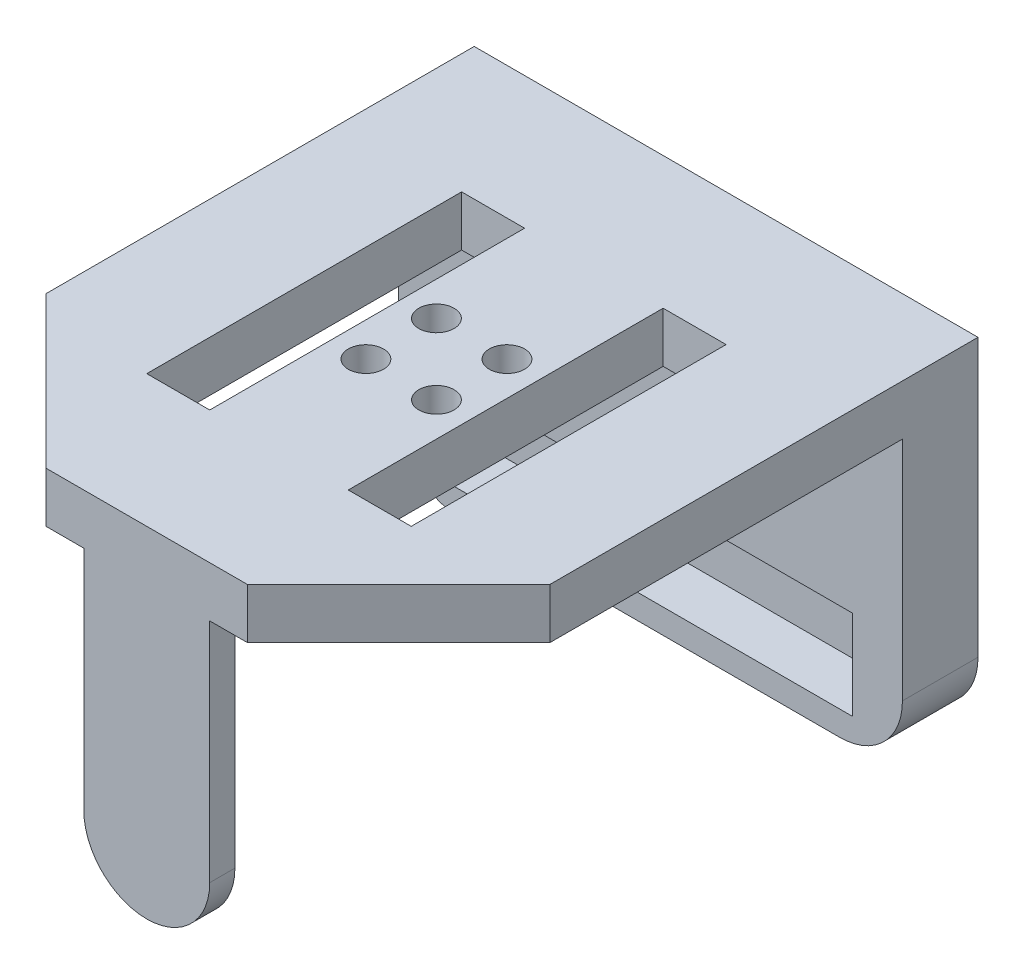
from build123d import *

# Parameters (mm, degrees)
SCHIZZO3_W                   = 40
SCHIZZO3_H                   = 27
ESTRUSIONE_ESTRUSIONE1_DEPTH = 6
SCHIZZO4_W                   = 32.1
SCHIZZO4_H                   = 7.1
TAGLIO_ESTRUSIONE1_DEPTH     = 4
SCHIZZO5_R                   = 1.05
TAGLIO_ESTRUSIONE2_DEPTH     = 25.459149617
SCHIZZO6_W                   = 40
SCHIZZO6_H                   = 4
ESTRUSIONE_ESTRUSIONE2_DEPTH = 40
SCHIZZO7_W                   = 10
SCHIZZO7_H                   = 2
ESTRUSIONE_ESTRUSIONE3_DEPTH = 23
SCHIZZO8_R                   = 1.4
SCHIZZO8_W                   = 5
SCHIZZO8_H                   = 25
TAGLIO_ESTRUSIONE3_DEPTH     = 57.964901475
RACCORDO1_R                  = 5


with BuildPart() as part:
    # Schizzo3 → Estrusione-Estrusione1 (new body)
    with BuildSketch(Plane.XY):
        Rectangle(SCHIZZO3_W, SCHIZZO3_H)
    extrude(amount=ESTRUSIONE_ESTRUSIONE1_DEPTH)

    # Schizzo4 → Taglio-Estrusione1 (cut)
    with BuildSketch(Plane.XY.offset(6)):
        with Locations((0, -8)):
            Rectangle(SCHIZZO4_W, SCHIZZO4_H)
    extrude(amount=-TAGLIO_ESTRUSIONE1_DEPTH, mode=Mode.SUBTRACT)

    # Schizzo5 → Taglio-Estrusione2 (cut, through all)
    with BuildSketch(Plane.XY.offset(2)):
        with Locations((0, -8)):
            Circle(SCHIZZO5_R)
    extrude(amount=-TAGLIO_ESTRUSIONE2_DEPTH, mode=Mode.SUBTRACT)

    # Schizzo6 → Estrusione-Estrusione2 (add)
    with BuildSketch(Plane.XY.offset(6)):
        with Locations((0, 11.5)):
            Rectangle(SCHIZZO6_W, SCHIZZO6_H)
    extrude(amount=ESTRUSIONE_ESTRUSIONE2_DEPTH)

    # Schizzo7 → Estrusione-Estrusione3 (add)
    with BuildSketch(Plane.XZ.offset(-9.5)):
        with Locations((0, 45)):
            Rectangle(SCHIZZO7_W, SCHIZZO7_H)
    extrude(amount=ESTRUSIONE_ESTRUSIONE3_DEPTH)

    # Schizzo8 → Taglio-Estrusione3 (cut, through all)
    with BuildSketch(Plane(origin=(0, 13.5, 0), x_dir=(1, 0, 0), z_dir=(0, 1, 0))):
        with Locations(Location((-2.8, -20.2, 0), (0, 0, 270))):
            Circle(SCHIZZO8_R)
        with Locations(Location((-2.8, -25.8, 0), (0, 0, 270))):
            Circle(SCHIZZO8_R)
        with Locations(Location((2.8, -25.8, 0), (0, 0, 270))):
            Circle(SCHIZZO8_R)
        with Locations(Location((2.8, -20.2, 0), (0, 0, 270))):
            Circle(SCHIZZO8_R)
        with Locations((8, -23)):
            Rectangle(SCHIZZO8_W, SCHIZZO8_H)
        with Locations((-8, -23)):
            Rectangle(SCHIZZO8_W, SCHIZZO8_H)
        Polygon((-20, -34), (-8, -46), (-20, -46), align=None)
        Polygon((8, -46), (20, -46), (20, -34), align=None)
    extrude(amount=-TAGLIO_ESTRUSIONE3_DEPTH, mode=Mode.SUBTRACT)

    # Raccordo1
    raccordo1_edges = [part.edges().sort_by_distance(p)[0] for p in [
        (-5, -13.5, 45),
        (5, -13.5, 45),
        (20, -13.5, 3),
        (-20, -13.5, 3),
    ]]
    fillet(raccordo1_edges, radius=RACCORDO1_R - 0.0001)  # a hair under: the kernel refuses the full size


solid = part.part
